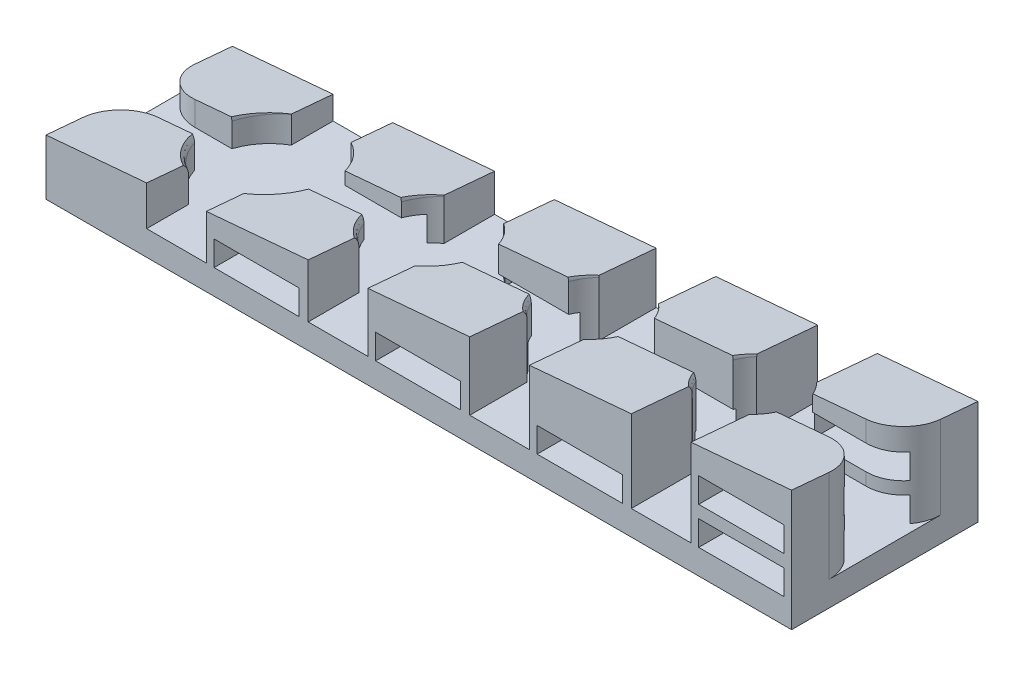
from build123d import *

# Parameters (mm, degrees)
SKETCH2_W           = 152.4
SKETCH2_H           = 38.1
BOSS_EXTRUDE1_DEPTH = 25.4
SKETCH3_R           = 8.9789
SKETCH3_R_2         = 9.5504
SKETCH3_R_3         = 10.6299
SKETCH3_R_4         = 12.1539
CUT_EXTRUDE1_DEPTH  = 20.32
SKETCH6_W           = 181.27171494
SKETCH6_H           = 81.384049634
CUT_EXTRUDE12_DEPTH = 13.97
SKETCH7_W           = 12.192
SKETCH7_H           = 152.907767239
CUT_EXTRUDE13_DEPTH = 59.69
LPATTERN1_COUNT     = 4
LPATTERN1_PITCH     = 33.02
SKETCH8_W           = 7.62
SKETCH8_H           = 158.942717159
CUT_EXTRUDE14_DEPTH = 199.136
FILLET1_R           = 2.54
SKETCH9_W           = 17.399
SKETCH9_H           = 5.08
CUT_EXTRUDE15_DEPTH = 199.136
FILLET2_R           = 7.62
SKETCH10_W          = 242.916122525
SKETCH10_H          = 111.998594032
CUT_EXTRUDE16_DEPTH = 16.256
LPATTERN2_COUNT     = 4
LPATTERN2_PITCH     = 33.02
LPATTERN3_COUNT     = 2
LPATTERN3_PITCH     = 7.62


with BuildPart() as part:
    # Sketch2 → Boss-Extrude1 (new body)
    with BuildSketch(Plane(origin=(0, 0, 0), x_dir=(1, 0, 0), z_dir=(0, 1, 0))):
        with Locations((-86.07386747, 25.062512801)):
            Rectangle(SKETCH2_W, SKETCH2_H)
    extrude(amount=BOSS_EXTRUDE1_DEPTH)

    # Sketch3 → Cut-Extrude1 (cut)
    with BuildSketch(Plane(origin=(0, 25.4, 0), x_dir=(1, 0, 0), z_dir=(0, 1, 0))):
        with Locations(Location((-36.54386747, 25.062512801, 0), (0, 0, 270))):
            Circle(SKETCH3_R)
        with Locations(Location((-69.56386747, 25.062512801, 0), (0, 0, 270))):
            Circle(SKETCH3_R_2)
        with Locations(Location((-102.58386747, 25.062512801, 0), (0, 0, 270))):
            Circle(SKETCH3_R_3)
        with Locations(Location((-135.60386747, 25.062512801, 0), (0, 0, 270))):
            Circle(SKETCH3_R_4)
    extrude(amount=-CUT_EXTRUDE1_DEPTH, mode=Mode.SUBTRACT)

    # Sketch6 → Cut-Extrude12 (cut)
    with BuildSketch(Plane(origin=(-3.437984194, 39.296339148, 0), x_dir=(0.9961946980917455, 0.08715574274765836, 0), z_dir=(-0.08715574274765836, 0.9961946980917455, 0))):
        with Locations((-79.821869176, 22.742168253)):
            Rectangle(SKETCH6_W, SKETCH6_H)
    extrude(amount=-CUT_EXTRUDE12_DEPTH, mode=Mode.SUBTRACT)

    # Sketch7 → Cut-Extrude13 (cut)
    with BuildSketch(Plane.XY.offset(-6.012512801)):
        with Locations((-36.54386747, 81.53388362)):
            Rectangle(SKETCH7_W, SKETCH7_H)
    cut_extrude13 = extrude(amount=-CUT_EXTRUDE13_DEPTH, mode=Mode.SUBTRACT)

    # LPattern1: Cut-Extrude13 ×4
    with Locations(*[(-i * LPATTERN1_PITCH, 0, 0) for i in range(1, LPATTERN1_COUNT)]):
        add(cut_extrude13, mode=Mode.SUBTRACT)

    # Sketch8 → Cut-Extrude14 (cut)
    with BuildSketch(Plane(origin=(-9.87386747, 0, 0), x_dir=(0, 0, -1), z_dir=(1, 0, 0))):
        with Locations((25.062512801, 84.55135858)):
            Rectangle(SKETCH8_W, SKETCH8_H)
    extrude(amount=-CUT_EXTRUDE14_DEPTH, mode=Mode.SUBTRACT)

    # Fillet1
    fillet1_edges = [part.edges().sort_by_distance(p)[0] for p in [
        (-110.958715685, 15.866130918, -18.516010576),
        (-94.209019255, 17.331539473, -31.609015026),
        (-145.036371888, 12.884722321, -17.397974615),
        (-126.171363052, 14.535196731, -32.727050988),
        (-145.036371888, 12.884722321, -32.727050988),
        (-43.791513361, 21.742499682, -30.362727348),
        (-77.198273644, 18.819786872, -30.800629438),
        (-110.958715685, 15.866130918, -31.609015026),
        (-29.296221579, 23.010673387, -19.762298254),
        (-61.929461296, 20.155634858, -19.324396165),
        (-94.209019255, 17.331539473, -18.516010576),
        (-126.171363052, 14.535196731, -17.397974615),
        (-43.791513361, 21.742499682, -19.762298254),
        (-29.296221579, 23.010673387, -30.362727348),
        (-77.198273644, 18.819786872, -19.324396165),
        (-61.929461296, 20.155634858, -30.800629438),
    ]]
    fillet(fillet1_edges, radius=FILLET1_R)

    # Sketch9 → Cut-Extrude15 (cut)
    with BuildSketch(Plane.XY.offset(-6.012512801)):
        with Locations((-20.16086747, 7.62)):
            Rectangle(SKETCH9_W, SKETCH9_H)
    cut_extrude15 = extrude(amount=-CUT_EXTRUDE15_DEPTH, mode=Mode.SUBTRACT)

    # Fillet2
    # the kernel refuses this fillet: 7.62 mm, written as the material it takes off along each edge
    with BuildSketch(Plane(origin=(-162.27386747, 5.08, -21.252512801), x_dir=(1, 0, 0), z_dir=(0, 1, 0))) as fillet2_piece_1:
        with BuildLine():
            CenterArc((FILLET2_R, -FILLET2_R), FILLET2_R, 90, 90)
            Line((0, -FILLET2_R), (0, 0))
            Line((0, 0), (FILLET2_R, 0))
        make_face()
    extrude(amount=25.34663687, mode=Mode.SUBTRACT)
    with BuildSketch(Plane(origin=(-162.27386747, 30.42663687, -28.872512801), x_dir=(0, 0, -1), z_dir=(0, -1, 0))) as fillet2_piece_2:
        with BuildLine():
            CenterArc((FILLET2_R, FILLET2_R), FILLET2_R, 180, 90)
            Line((0, FILLET2_R), (0, 0))
            Line((0, 0), (FILLET2_R, 0))
        make_face()
    extrude(amount=25.34663687, mode=Mode.SUBTRACT)
    with BuildSketch(Plane(origin=(-9.87386747, 43.759909191, -21.252512801), x_dir=(0, 0, 1), z_dir=(0, -1, 0)), Plane(origin=(-9.87386747, 5.08, -28.872512801), x_dir=(0, 0, -1), z_dir=(0, 1, 0))) as fillet2_piece_3:
        with BuildLine():
            CenterArc((FILLET2_R, FILLET2_R), FILLET2_R, 180, 90)
            Line((0, FILLET2_R), (0, 0))
            Line((0, 0), (FILLET2_R, 0))
        make_face()
    extrude(amount=38.679909191, mode=Mode.SUBTRACT)

    # Sketch10 → Cut-Extrude16 (cut)
    with BuildSketch(Plane(origin=(-2.249049889, 25.706757865, -2.257640894), x_dir=(0.9961946980917464, 0.08715574274764909, 0), z_dir=(-0.0868240888334561, 0.9924038765061047, -0.08715574274765839))):
        with Locations((-78.246671801, 29.182123031)):
            Rectangle(SKETCH10_W, SKETCH10_H)
    extrude(amount=CUT_EXTRUDE16_DEPTH, mode=Mode.SUBTRACT)

    # LPattern2: Cut-Extrude15 ×4
    with Locations(*[(-i * LPATTERN2_PITCH, 0, 0) for i in range(1, LPATTERN2_COUNT)]):
        add(cut_extrude15, mode=Mode.SUBTRACT)

    # LPattern3: Cut-Extrude15 ×2
    with Locations(*[(0, i * LPATTERN3_PITCH, 0) for i in range(1, LPATTERN3_COUNT)]):
        add(cut_extrude15, mode=Mode.SUBTRACT)


solid = part.part
